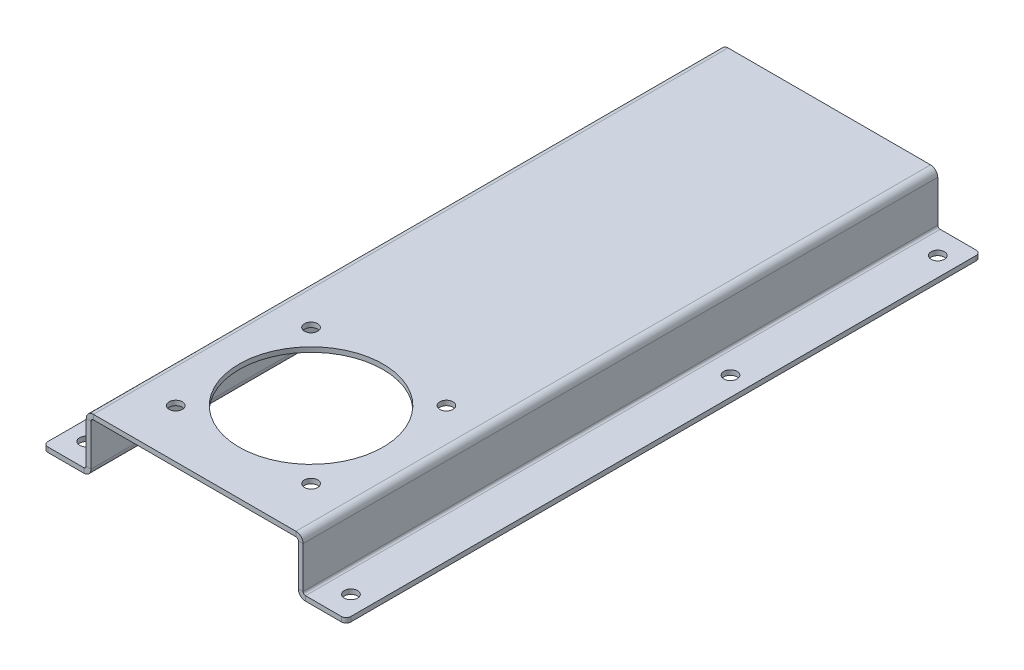
from build123d import *

# Parameters (mm, degrees)
BASE_FLANGE1_DEPTH = 199
CUT_EXTRUDE1_REACH = 224.823
SKETCH6_R          = 4.15
FILLET1_R          = 3
CUT_EXTRUDE2_REACH = 225.273
SKETCH8_R          = 45.15
SKETCH8_R_2        = 4.15


# Sheet-metal steps are written as plain solids
with BuildPart() as part:
    # Sketch1 → Base-Flange1 (new, symmetric)
    with BuildSketch(Plane.XY):
        with BuildLine():
            Line((-95, 0), (-69.5, 0))
            ThreePointArc((-69.5, 0), (-66.318019485, 1.318019485), (-65, 4.5))
            Line((-65, 4.5), (-65, 30.5))
            ThreePointArc((-65, 30.5), (-64.560660172, 31.560660172), (-63.5, 32))
            Line((-63.5, 32), (63.5, 32))
            ThreePointArc((63.5, 32), (64.560660172, 31.560660172), (65, 30.5))
            Line((65, 30.5), (65, 4.5))
            ThreePointArc((65, 4.5), (66.318019485, 1.318019485), (69.5, 0))
            Line((69.5, 0), (95, 0))
            Line((95, 0), (95, 3))
            Line((95, 3), (69.5, 3))
            ThreePointArc((69.5, 3), (68.439339828, 3.439339828), (68, 4.5))
            Line((68, 4.5), (68, 30.5))
            ThreePointArc((68, 30.5), (66.681980515, 33.681980515), (63.5, 35))
            Line((63.5, 35), (-63.5, 35))
            ThreePointArc((-63.5, 35), (-66.681980515, 33.681980515), (-68, 30.5))
            Line((-68, 30.5), (-68, 4.5))
            ThreePointArc((-68, 4.5), (-68.439339828, 3.439339828), (-69.5, 3))
            Line((-69.5, 3), (-95, 3))
            Line((-95, 3), (-95, 0))
        make_face()
    extrude(amount=BASE_FLANGE1_DEPTH, both=True)

    # Sketch6 → Cut-Extrude1 (cut, up to next)
    with BuildSketch(Plane(origin=(0, 3, 0), x_dir=(1, 0, 0), z_dir=(0, 1, 0)), mode=Mode.PRIVATE) as cut_extrude1_sk1:
        with Locations(Location((-83, -184, 0), (0, 0, 180))):
            Circle(SKETCH6_R)
    cut_extrude1_tool1 = extrude(cut_extrude1_sk1.sketch, amount=-CUT_EXTRUDE1_REACH, mode=Mode.PRIVATE) & part.part
    # Sketch6 → Cut-Extrude1 (cut, up to next)
    with BuildSketch(Plane(origin=(0, 3, 0), x_dir=(1, 0, 0), z_dir=(0, 1, 0)), mode=Mode.PRIVATE) as cut_extrude1_sk2:
        with Locations(Location((-83, 54, 0), (0, 0, 180))):
            Circle(SKETCH6_R)
    cut_extrude1_tool2 = extrude(cut_extrude1_sk2.sketch, amount=-CUT_EXTRUDE1_REACH, mode=Mode.PRIVATE) & part.part
    # Sketch6 → Cut-Extrude1 (cut, up to next)
    with BuildSketch(Plane(origin=(0, 3, 0), x_dir=(1, 0, 0), z_dir=(0, 1, 0)), mode=Mode.PRIVATE) as cut_extrude1_sk3:
        with Locations(Location((-83, 184, 0), (0, 0, 180))):
            Circle(SKETCH6_R)
    cut_extrude1_tool3 = extrude(cut_extrude1_sk3.sketch, amount=-CUT_EXTRUDE1_REACH, mode=Mode.PRIVATE) & part.part
    # Sketch6 → Cut-Extrude1 (cut, up to next)
    with BuildSketch(Plane(origin=(0, 3, 0), x_dir=(1, 0, 0), z_dir=(0, 1, 0)), mode=Mode.PRIVATE) as cut_extrude1_sk4:
        with Locations((83, 184)):
            Circle(SKETCH6_R)
    cut_extrude1_tool4 = extrude(cut_extrude1_sk4.sketch, amount=-CUT_EXTRUDE1_REACH, mode=Mode.PRIVATE) & part.part
    # Sketch6 → Cut-Extrude1 (cut, up to next)
    with BuildSketch(Plane(origin=(0, 3, 0), x_dir=(1, 0, 0), z_dir=(0, 1, 0)), mode=Mode.PRIVATE) as cut_extrude1_sk5:
        with Locations((83, 54)):
            Circle(SKETCH6_R)
    cut_extrude1_tool5 = extrude(cut_extrude1_sk5.sketch, amount=-CUT_EXTRUDE1_REACH, mode=Mode.PRIVATE) & part.part
    # Sketch6 → Cut-Extrude1 (cut, up to next)
    with BuildSketch(Plane(origin=(0, 3, 0), x_dir=(1, 0, 0), z_dir=(0, 1, 0)), mode=Mode.PRIVATE) as cut_extrude1_sk6:
        with Locations((83, -184)):
            Circle(SKETCH6_R)
    cut_extrude1_tool6 = extrude(cut_extrude1_sk6.sketch, amount=-CUT_EXTRUDE1_REACH, mode=Mode.PRIVATE) & part.part
    add(cut_extrude1_tool1.solids().sort_by_distance((-83, 3, 184))[0], mode=Mode.SUBTRACT)
    add(cut_extrude1_tool2.solids().sort_by_distance((-83, 3, -54))[0], mode=Mode.SUBTRACT)
    add(cut_extrude1_tool3.solids().sort_by_distance((-83, 3, -184))[0], mode=Mode.SUBTRACT)
    add(cut_extrude1_tool4.solids().sort_by_distance((83, 3, -184))[0], mode=Mode.SUBTRACT)
    add(cut_extrude1_tool5.solids().sort_by_distance((83, 3, -54))[0], mode=Mode.SUBTRACT)
    add(cut_extrude1_tool6.solids().sort_by_distance((83, 3, 184))[0], mode=Mode.SUBTRACT)

    # Fillet1
    fillet1_edges = [part.edges().sort_by_distance(p)[0] for p in [
        (95, 1.5, -199),
        (-95, 1.5, -199),
        (95, 1.5, 199),
        (-95, 1.5, 199),
    ]]
    fillet(fillet1_edges, radius=FILLET1_R)

    # Sketch8 → Cut-Extrude2 (cut, up to next)
    with BuildSketch(Plane(origin=(0, 35, 0), x_dir=(1, 0, 0), z_dir=(0, 1, 0)), mode=Mode.PRIVATE) as cut_extrude2_sk1:
        with Locations(Location((0, -126, 0), (0, 0, 270))):
            Circle(SKETCH8_R)
    cut_extrude2_tool1 = extrude(cut_extrude2_sk1.sketch, amount=-CUT_EXTRUDE2_REACH, mode=Mode.PRIVATE) & part.part
    # Sketch8 → Cut-Extrude2 (cut, up to next)
    with BuildSketch(Plane(origin=(0, 35, 0), x_dir=(1, 0, 0), z_dir=(0, 1, 0)), mode=Mode.PRIVATE) as cut_extrude2_sk2:
        with Locations(Location((-42.426406871, -83.573593129, 0), (0, 0, 270))):
            Circle(SKETCH8_R_2)
    cut_extrude2_tool2 = extrude(cut_extrude2_sk2.sketch, amount=-CUT_EXTRUDE2_REACH, mode=Mode.PRIVATE) & part.part
    # Sketch8 → Cut-Extrude2 (cut, up to next)
    with BuildSketch(Plane(origin=(0, 35, 0), x_dir=(1, 0, 0), z_dir=(0, 1, 0)), mode=Mode.PRIVATE) as cut_extrude2_sk3:
        with Locations(Location((42.426406871, -83.573593129, 0), (0, 0, 270))):
            Circle(SKETCH8_R_2)
    cut_extrude2_tool3 = extrude(cut_extrude2_sk3.sketch, amount=-CUT_EXTRUDE2_REACH, mode=Mode.PRIVATE) & part.part
    # Sketch8 → Cut-Extrude2 (cut, up to next)
    with BuildSketch(Plane(origin=(0, 35, 0), x_dir=(1, 0, 0), z_dir=(0, 1, 0)), mode=Mode.PRIVATE) as cut_extrude2_sk4:
        with Locations(Location((42.426406871, -168.426406871, 0), (0, 0, 270))):
            Circle(SKETCH8_R_2)
    cut_extrude2_tool4 = extrude(cut_extrude2_sk4.sketch, amount=-CUT_EXTRUDE2_REACH, mode=Mode.PRIVATE) & part.part
    # Sketch8 → Cut-Extrude2 (cut, up to next)
    with BuildSketch(Plane(origin=(0, 35, 0), x_dir=(1, 0, 0), z_dir=(0, 1, 0)), mode=Mode.PRIVATE) as cut_extrude2_sk5:
        with Locations(Location((-42.426406871, -168.426406871, 0), (0, 0, 270))):
            Circle(SKETCH8_R_2)
    cut_extrude2_tool5 = extrude(cut_extrude2_sk5.sketch, amount=-CUT_EXTRUDE2_REACH, mode=Mode.PRIVATE) & part.part
    add(cut_extrude2_tool1.solids().sort_by_distance((0, 35, 126))[0], mode=Mode.SUBTRACT)
    add(cut_extrude2_tool2.solids().sort_by_distance((-42.426407, 35, 83.573593))[0], mode=Mode.SUBTRACT)
    add(cut_extrude2_tool3.solids().sort_by_distance((42.426407, 35, 83.573593))[0], mode=Mode.SUBTRACT)
    add(cut_extrude2_tool4.solids().sort_by_distance((42.426407, 35, 168.426407))[0], mode=Mode.SUBTRACT)
    add(cut_extrude2_tool5.solids().sort_by_distance((-42.426407, 35, 168.426407))[0], mode=Mode.SUBTRACT)


solid = part.part
